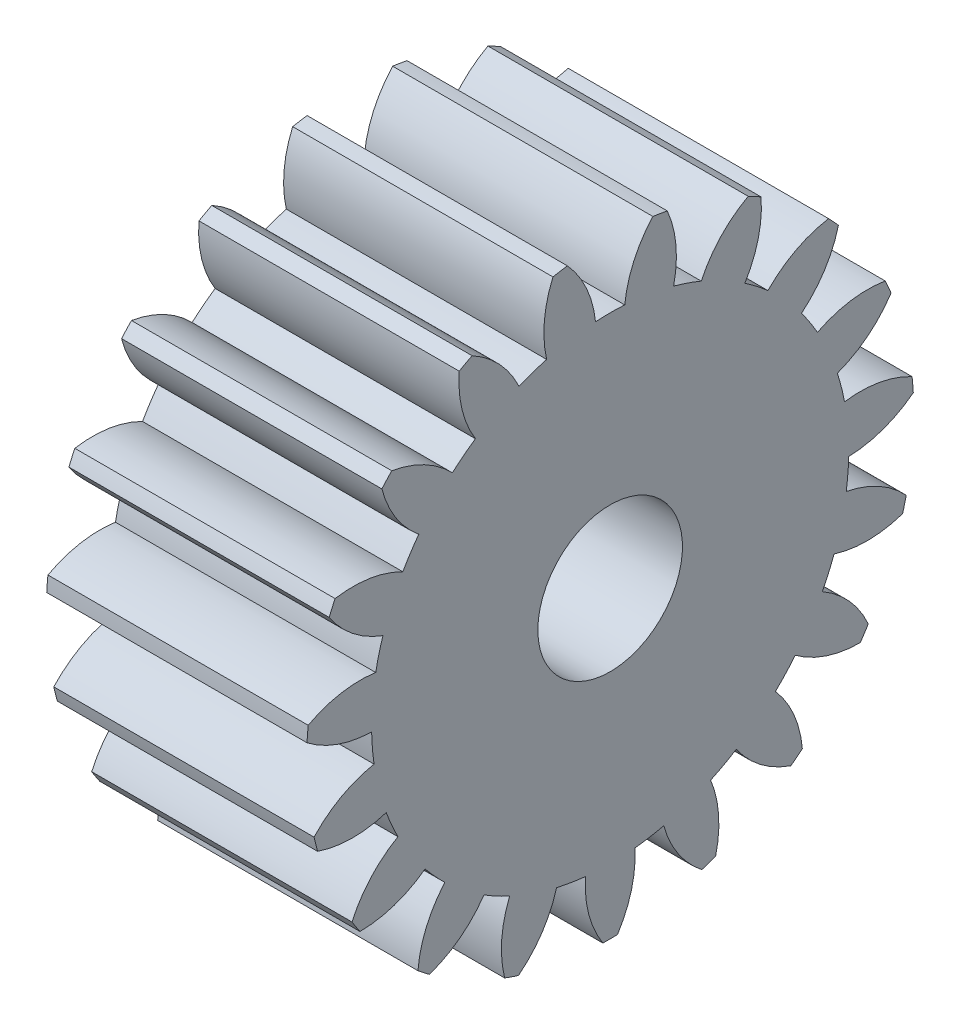
from build123d import *

# Parameters (mm, degrees)
SPUR_START             = 223.218838191
SPUR_GEAR_AM_OUTLINE_R = 2.5
SPUR_GEAR_AM_DEPTH     = 6
BOSS_EXTRUDE2_START    = -3
SKETCH4_R              = 2.5
BOSS_EXTRUDE2_DEPTH    = 3


# Read off the part's stored shape, not the designer's step: spur gear_am
with BuildPart() as part:
    # spur gear_am outline → spur gear_am (new body)
    with BuildSketch(Plane.YZ.offset(SPUR_START)):
        with BuildLine():
            ThreePointArc((211.475737045, -226.442266721), (211.291868278, -226.268869388), (211.103879422, -226.099947664))
            ThreePointArc((211.103879422, -226.099947664), (210.003020465, -226.578891651), (209.10651348, -227.377360819))
            ThreePointArc((209.10651348, -227.377360819), (208.692187132, -227.088184171), (208.260933872, -226.82491609))
            ThreePointArc((208.260933872, -226.82491609), (208.632027885, -225.683177494), (208.628422007, -224.482650616))
            ThreePointArc((208.628422007, -224.482650616), (208.398213735, -224.37835052), (208.16556184, -224.279621323))
            ThreePointArc((208.16556184, -224.279621323), (207.279863315, -225.090063122), (206.691194067, -226.136364371))
            ThreePointArc((206.691194067, -226.136364371), (206.20542156, -225.997387656), (205.712051785, -225.888411871))
            ThreePointArc((205.712051785, -225.888411871), (205.692316984, -224.688041793), (205.299096042, -223.553733599))
            ThreePointArc((205.299096042, -223.553733599), (205.047494903, -223.529833273), (204.795391412, -223.511995443))
            ThreePointArc((204.795391412, -223.511995443), (204.220832498, -224.566111111), (204.003792434, -225.746861465))
            ThreePointArc((204.003792434, -225.746861465), (203.499214755, -225.773144967), (202.997192736, -225.830270694))
            ThreePointArc((202.997192736, -225.830270694), (202.588767694, -224.701347857), (201.848543279, -223.756178241))
            ThreePointArc((201.848543279, -223.756178241), (201.602814161, -223.815267658), (201.358578398, -223.8802542))
            ThreePointArc((201.358578398, -223.8802542), (201.157421469, -225.063813948), (201.335530247, -226.251060784))
            ThreePointArc((201.335530247, -226.251060784), (200.866826218, -226.439756278), (200.41055383, -226.656793059))
            ThreePointArc((200.41055383, -226.656793059), (199.657697737, -225.721653769), (198.65068465, -225.068046525))
            ThreePointArc((198.65068465, -225.068046525), (198.437456116, -225.203722428), (198.227554816, -225.344491043))
            ThreePointArc((198.227554816, -225.344491043), (198.421598346, -226.529237808), (198.975555117, -227.59432451))
            ThreePointArc((198.975555117, -227.59432451), (198.593516092, -227.924983911), (198.232437527, -228.278412442))
            ThreePointArc((198.232437527, -228.278412442), (197.216734024, -227.638393552), (196.052057758, -227.347177166))
            ThreePointArc((196.052057758, -227.347177166), (195.894436427, -227.544736967), (195.741615653, -227.74603319))
            ThreePointArc((195.741615653, -227.74603319), (196.309832015, -228.803581275), (197.179606967, -229.631089173))
            ThreePointArc((197.179606967, -229.631089173), (196.925632802, -230.067880405), (196.698876527, -230.519401222))
            ThreePointArc((196.698876527, -230.519401222), (195.530392847, -230.243858709), (194.334264148, -230.346590995))
            ThreePointArc((194.334264148, -230.346590995), (194.249330738, -230.584626023), (194.170150992, -230.824636287))
            ThreePointArc((194.170150992, -230.824636287), (195.050965127, -231.640383948), (196.142304648, -232.14063972))
            ThreePointArc((196.142304648, -232.14063972), (196.043917384, -232.636229675), (195.976055959, -233.136913491))
            ThreePointArc((195.976055959, -233.136913491), (194.78141544, -233.255706662), (193.683453412, -233.741254983))
            ThreePointArc((193.683453412, -233.741254983), (193.680411776, -233.99397045), (193.683453412, -234.246685917))
            ThreePointArc((193.683453412, -234.246685917), (194.78141544, -234.732234238), (195.976055959, -234.851027409))
            ThreePointArc((195.976055959, -234.851027409), (196.043917384, -235.351711225), (196.142304648, -235.84730118))
            ThreePointArc((196.142304648, -235.84730118), (195.050965127, -236.347556952), (194.170150992, -237.163304613))
            ThreePointArc((194.170150992, -237.163304613), (194.249330738, -237.403314877), (194.334264148, -237.641349905))
            ThreePointArc((194.334264148, -237.641349905), (195.530392847, -237.744082191), (196.698876527, -237.468539678))
            ThreePointArc((196.698876527, -237.468539678), (196.925632802, -237.920060495), (197.179606967, -238.356851727))
            ThreePointArc((197.179606967, -238.356851727), (196.309832016, -239.184359624), (195.741615653, -240.241907709))
            ThreePointArc((195.741615653, -240.241907709), (195.894436427, -240.443203933), (196.052057758, -240.640763734))
            ThreePointArc((196.052057758, -240.640763734), (197.216734024, -240.349547348), (198.232437527, -239.709528458))
            ThreePointArc((198.232437527, -239.709528458), (198.593516092, -240.062956989), (198.975555117, -240.39361639))
            ThreePointArc((198.975555117, -240.39361639), (198.421598346, -241.458703092), (198.227554816, -242.643449857))
            ThreePointArc((198.227554816, -242.643449857), (198.437456116, -242.784218472), (198.65068465, -242.919894375))
            ThreePointArc((198.65068465, -242.919894375), (199.657697737, -242.266287131), (200.41055383, -241.331147841))
            ThreePointArc((200.41055383, -241.331147841), (200.866826218, -241.548184622), (201.335530247, -241.736880115))
            ThreePointArc((201.335530247, -241.736880115), (201.157421469, -242.924126952), (201.358578398, -244.1076867))
            ThreePointArc((201.358578398, -244.1076867), (201.602814161, -244.172673242), (201.848543279, -244.231762659))
            ThreePointArc((201.848543279, -244.231762659), (202.588767694, -243.286593043), (202.997192736, -242.157670206))
            ThreePointArc((202.997192736, -242.157670206), (203.499214755, -242.214795933), (204.003792434, -242.241079435))
            ThreePointArc((204.003792434, -242.241079435), (204.220832498, -243.421829789), (204.795391412, -244.475945457))
            ThreePointArc((204.795391412, -244.475945457), (205.047494903, -244.458107627), (205.299096042, -244.434207301))
            ThreePointArc((205.299096042, -244.434207301), (205.692316984, -243.299899107), (205.712051785, -242.099529029))
            ThreePointArc((205.712051785, -242.099529029), (206.20542156, -241.990553244), (206.691194067, -241.851576529))
            ThreePointArc((206.691194067, -241.851576529), (207.279863315, -242.897877778), (208.16556184, -243.708319577))
            ThreePointArc((208.16556184, -243.708319577), (208.398213735, -243.60959038), (208.628422007, -243.505290284))
            ThreePointArc((208.628422007, -243.505290284), (208.632027885, -242.304763406), (208.260933872, -241.16302481))
            ThreePointArc((208.260933872, -241.16302481), (208.692187132, -240.899756729), (209.10651348, -240.61058008))
            ThreePointArc((209.10651348, -240.61058008), (210.003020465, -241.409049249), (211.103879422, -241.887993236))
            ThreePointArc((211.103879422, -241.887993236), (211.291868278, -241.719071512), (211.475737045, -241.545674179))
            ThreePointArc((211.475737045, -241.545674179), (211.089337107, -240.409024332), (210.367628075, -239.449642312))
            ThreePointArc((210.367628075, -239.449642312), (210.690031838, -239.060611117), (210.988013337, -238.652571312))
            ThreePointArc((210.988013337, -238.652571312), (212.095207616, -239.116681876), (213.291931857, -239.212227038))
            ThreePointArc((213.291931857, -239.212227038), (213.414886164, -238.991418077), (213.532490392, -238.767713799))
            ThreePointArc((213.532490392, -238.767713799), (212.797957066, -237.81811463), (211.803841388, -237.145053113))
            ThreePointArc((211.803841388, -237.145053113), (211.982458203, -236.672416371), (212.131803934, -236.189730854))
            ThreePointArc((212.131803934, -236.189730854), (213.329703827, -236.269189233), (214.492609711, -235.970981768))
            ThreePointArc((214.492609711, -235.970981768), (214.537205462, -235.722213648), (214.575800908, -235.472444254))
            ThreePointArc((214.575800908, -235.472444254), (213.572732278, -234.812799569), (212.413937812, -234.498995215))
            ThreePointArc((212.413937812, -234.498995215), (212.429411776, -233.99397045), (212.413937812, -233.488945685))
            ThreePointArc((212.413937812, -233.488945685), (213.572732278, -233.175141331), (214.575800908, -232.515496646))
            ThreePointArc((214.575800908, -232.515496646), (214.537205462, -232.265727252), (214.492609711, -232.016959132))
            ThreePointArc((214.492609711, -232.016959132), (213.329703827, -231.718751667), (212.131803934, -231.798210046))
            ThreePointArc((212.131803934, -231.798210046), (211.982458203, -231.315524528), (211.803841388, -230.842887786))
            ThreePointArc((211.803841388, -230.842887786), (212.797957066, -230.16982627), (213.532490392, -229.220227101))
            ThreePointArc((213.532490392, -229.220227101), (213.414886164, -228.996522823), (213.291931857, -228.775713862))
            ThreePointArc((213.291931857, -228.775713862), (212.095207616, -228.871259024), (210.988013337, -229.335369588))
            ThreePointArc((210.988013337, -229.335369588), (210.690031838, -228.927329783), (210.367628075, -228.538298588))
            ThreePointArc((210.367628075, -228.538298588), (211.089337107, -227.578916568), (211.475737045, -226.442266721))
        make_face()
        with Locations((204.180411776, -233.99397045)):
            Circle(SPUR_GEAR_AM_OUTLINE_R, mode=Mode.SUBTRACT)
    extrude(amount=SPUR_GEAR_AM_DEPTH)

    # Sketch4 → Boss-Extrude2 (add)
    with BuildSketch(Plane(origin=(223.218838191, 204.180411776, -233.99397045), x_dir=(0, 0, -1), z_dir=(1, 0, 0)).offset(BOSS_EXTRUDE2_START)):
        with BuildLine():
            ThreePointArc((-7.894022786, 6.923467646), (-7.415078799, 5.822608689), (-6.61660963, 4.926101704))
            ThreePointArc((-6.61660963, 4.926101704), (-6.905786279, 4.511775356), (-7.16905436, 4.080522097))
            ThreePointArc((-7.16905436, 4.080522097), (-8.310792956, 4.45161611), (-9.511319834, 4.448010231))
            ThreePointArc((-9.511319834, 4.448010231), (-9.61561993, 4.217801959), (-9.714349127, 3.985150064))
            ThreePointArc((-9.714349127, 3.985150064), (-8.903907328, 3.099451539), (-7.857606079, 2.510782291))
            ThreePointArc((-7.857606079, 2.510782291), (-7.996582794, 2.025009783), (-8.105558579, 1.531640009))
            ThreePointArc((-8.105558579, 1.531640009), (-9.305928658, 1.511905208), (-10.440236851, 1.118684266))
            ThreePointArc((-10.440236851, 1.118684266), (-10.464137177, 0.867083127), (-10.481975007, 0.614979636))
            ThreePointArc((-10.481975007, 0.614979636), (-9.427859339, 0.040420723), (-8.247108985, -0.176619342))
            ThreePointArc((-8.247108985, -0.176619342), (-8.220825483, -0.681197021), (-8.163699756, -1.18321904))
            ThreePointArc((-8.163699756, -1.18321904), (-9.292622593, -1.591644082), (-10.237792209, -2.331868497))
            ThreePointArc((-10.237792209, -2.331868497), (-10.178702792, -2.577597615), (-10.11371625, -2.821833378))
            ThreePointArc((-10.11371625, -2.821833378), (-8.930156502, -3.022990307), (-7.742909665, -2.844881529))
            ThreePointArc((-7.742909665, -2.844881529), (-7.554214172, -3.313585558), (-7.337177391, -3.769857946))
            ThreePointArc((-7.337177391, -3.769857946), (-8.272316681, -4.522714039), (-8.925923925, -5.529727126))
            ThreePointArc((-8.925923925, -5.529727126), (-8.790248022, -5.74295566), (-8.649479407, -5.95285696))
            ThreePointArc((-8.649479407, -5.95285696), (-7.464732643, -5.75881343), (-6.39964594, -5.204856659))
            ThreePointArc((-6.39964594, -5.204856659), (-6.068986539, -5.586895684), (-5.715558008, -5.947974249))
            ThreePointArc((-5.715558008, -5.947974249), (-6.355576898, -6.963677752), (-6.646793284, -8.128354018))
            ThreePointArc((-6.646793284, -8.128354018), (-6.449233483, -8.285975349), (-6.247937259, -8.438796123))
            ThreePointArc((-6.247937259, -8.438796123), (-5.190389174, -7.87057976), (-4.362881277, -7.000804808))
            ThreePointArc((-4.362881277, -7.000804808), (-3.926090045, -7.254778974), (-3.474569228, -7.481535249))
            ThreePointArc((-3.474569228, -7.481535249), (-3.750111741, -8.650018929), (-3.647379455, -9.846147628))
            ThreePointArc((-3.647379455, -9.846147628), (-3.409344427, -9.931081038), (-3.169334163, -10.010260784))
            ThreePointArc((-3.169334163, -10.010260784), (-2.353586502, -9.129446649), (-1.85333073, -8.038107128))
            ThreePointArc((-1.85333073, -8.038107128), (-1.357740775, -8.136494392), (-0.857056959, -8.204355817))
            ThreePointArc((-0.857056959, -8.204355817), (-0.738263788, -9.398996336), (-0.252715467, -10.496958364))
            ThreePointArc((-0.252715467, -10.496958364), (0, -10.5), (0.252715467, -10.496958364))
            ThreePointArc((0.252715467, -10.496958364), (0.738263788, -9.398996336), (0.857056959, -8.204355817))
            ThreePointArc((0.857056959, -8.204355817), (1.357740775, -8.136494392), (1.85333073, -8.038107128))
            ThreePointArc((1.85333073, -8.038107128), (2.353586502, -9.129446649), (3.169334163, -10.010260784))
            ThreePointArc((3.169334163, -10.010260784), (3.409344427, -9.931081038), (3.647379455, -9.846147628))
            ThreePointArc((3.647379455, -9.846147628), (3.750111741, -8.650018929), (3.474569228, -7.481535249))
            ThreePointArc((3.474569228, -7.481535249), (3.926090045, -7.254778974), (4.362881277, -7.000804808))
            ThreePointArc((4.362881277, -7.000804808), (5.190389174, -7.87057976), (6.247937259, -8.438796123))
            ThreePointArc((6.247937259, -8.438796123), (6.449233483, -8.285975349), (6.646793284, -8.128354018))
            ThreePointArc((6.646793284, -8.128354018), (6.355576898, -6.963677752), (5.715558008, -5.947974249))
            ThreePointArc((5.715558008, -5.947974249), (6.068986539, -5.586895684), (6.39964594, -5.204856659))
            ThreePointArc((6.39964594, -5.204856659), (7.464732643, -5.75881343), (8.649479407, -5.95285696))
            ThreePointArc((8.649479407, -5.95285696), (8.790248022, -5.74295566), (8.925923925, -5.529727126))
            ThreePointArc((8.925923925, -5.529727126), (8.272316681, -4.522714039), (7.337177391, -3.769857946))
            ThreePointArc((7.337177391, -3.769857946), (7.554214172, -3.313585558), (7.742909665, -2.844881529))
            ThreePointArc((7.742909665, -2.844881529), (8.930156502, -3.022990307), (10.11371625, -2.821833378))
            ThreePointArc((10.11371625, -2.821833378), (10.178702792, -2.577597615), (10.237792209, -2.331868497))
            ThreePointArc((10.237792209, -2.331868497), (9.292622593, -1.591644082), (8.163699756, -1.18321904))
            ThreePointArc((8.163699756, -1.18321904), (8.220825483, -0.681197021), (8.247108985, -0.176619342))
            ThreePointArc((8.247108985, -0.176619342), (9.427859339, 0.040420723), (10.481975007, 0.614979636))
            ThreePointArc((10.481975007, 0.614979636), (10.464137177, 0.867083127), (10.440236851, 1.118684266))
            ThreePointArc((10.440236851, 1.118684266), (9.305928658, 1.511905208), (8.105558579, 1.531640009))
            ThreePointArc((8.105558579, 1.531640009), (7.996582794, 2.025009783), (7.857606079, 2.510782291))
            ThreePointArc((7.857606079, 2.510782291), (8.903907328, 3.099451539), (9.714349127, 3.985150064))
            ThreePointArc((9.714349127, 3.985150064), (9.61561993, 4.217801959), (9.511319834, 4.448010231))
            ThreePointArc((9.511319834, 4.448010231), (8.310792956, 4.45161611), (7.16905436, 4.080522097))
            ThreePointArc((7.16905436, 4.080522097), (6.905786279, 4.511775356), (6.61660963, 4.926101704))
            ThreePointArc((6.61660963, 4.926101704), (7.415078799, 5.822608689), (7.894022786, 6.923467646))
            ThreePointArc((7.894022786, 6.923467646), (7.725101062, 7.111456502), (7.551703729, 7.295325269))
            ThreePointArc((7.551703729, 7.295325269), (6.415053882, 6.908925331), (5.455671862, 6.1872163))
            ThreePointArc((5.455671862, 6.1872163), (5.066640667, 6.509620062), (4.658600862, 6.807601561))
            ThreePointArc((4.658600862, 6.807601561), (5.122711426, 7.91479584), (5.218256588, 9.111520081))
            ThreePointArc((5.218256588, 9.111520081), (4.997447627, 9.234474388), (4.773743349, 9.352078616))
            ThreePointArc((4.773743349, 9.352078616), (3.82414418, 8.61754529), (3.151082664, 7.623429612))
            ThreePointArc((3.151082664, 7.623429612), (2.678445921, 7.802046427), (2.195760404, 7.951392158))
            ThreePointArc((2.195760404, 7.951392158), (2.275218783, 9.149292051), (1.977011318, 10.312197935))
            ThreePointArc((1.977011318, 10.312197935), (1.728243198, 10.356793686), (1.478473804, 10.395389132))
            ThreePointArc((1.478473804, 10.395389132), (0.818829119, 9.392320502), (0.505024765, 8.233526036))
            ThreePointArc((0.505024765, 8.233526036), (0, 8.249), (-0.505024765, 8.233526036))
            ThreePointArc((-0.505024765, 8.233526036), (-0.818829119, 9.392320502), (-1.478473804, 10.395389132))
            ThreePointArc((-1.478473804, 10.395389132), (-1.728243198, 10.356793686), (-1.977011318, 10.312197935))
            ThreePointArc((-1.977011318, 10.312197935), (-2.275218783, 9.149292051), (-2.195760404, 7.951392158))
            ThreePointArc((-2.195760404, 7.951392158), (-2.678445921, 7.802046427), (-3.151082664, 7.623429612))
            ThreePointArc((-3.151082664, 7.623429612), (-3.82414418, 8.61754529), (-4.773743349, 9.352078616))
            ThreePointArc((-4.773743349, 9.352078616), (-4.997447627, 9.234474388), (-5.218256588, 9.111520081))
            ThreePointArc((-5.218256588, 9.111520081), (-5.122711426, 7.91479584), (-4.658600862, 6.807601561))
            ThreePointArc((-4.658600862, 6.807601561), (-5.066640667, 6.509620062), (-5.455671862, 6.1872163))
            ThreePointArc((-5.455671862, 6.1872163), (-6.415053882, 6.908925331), (-7.551703729, 7.295325269))
            ThreePointArc((-7.551703729, 7.295325269), (-7.725101062, 7.111456502), (-7.894022786, 6.923467646))
        make_face()
        with Locations(Location((0, 0, 0), (0, 0, 180))):
            Circle(SKETCH4_R, mode=Mode.SUBTRACT)
    extrude(amount=BOSS_EXTRUDE2_DEPTH)


solid = part.part
